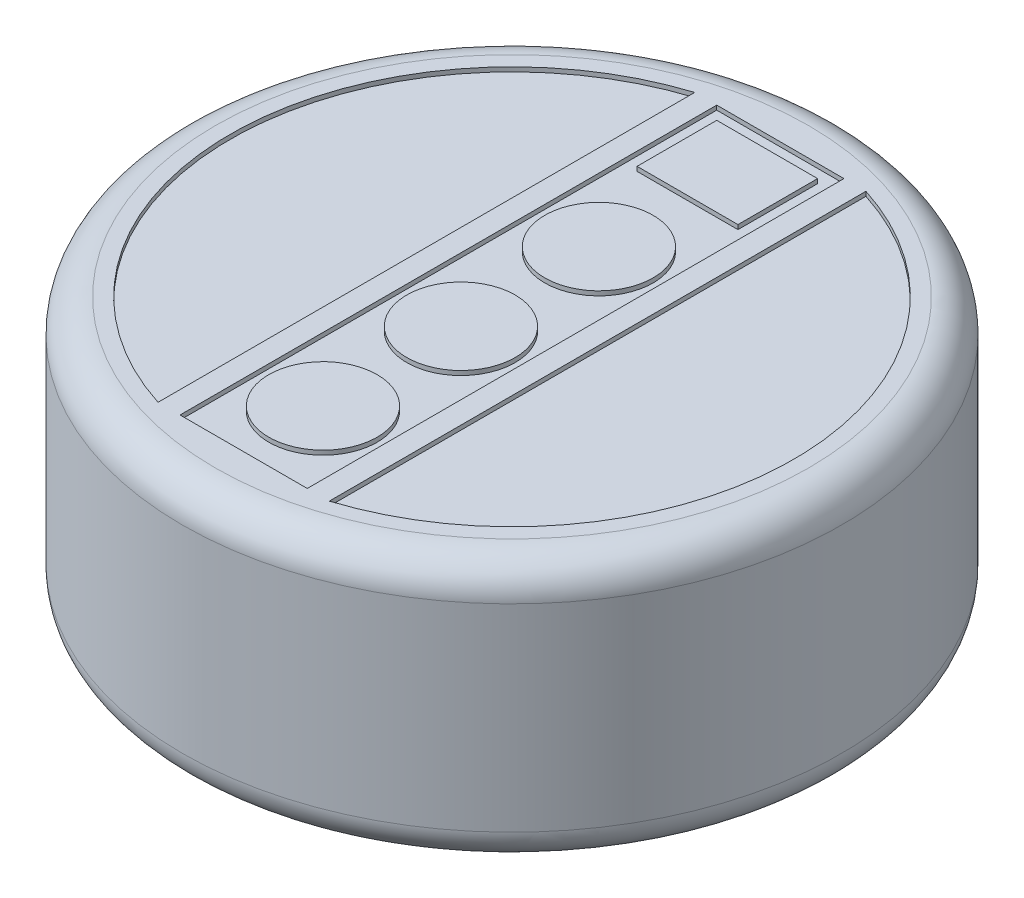
from build123d import *

# Parameters (mm, degrees)
SKETCH1_R           = 190.5
BOSS_EXTRUDE1_DEPTH = 152.4
SKETCH4_W           = 73.557387936
SKETCH4_H           = 310.235544462
CUT_EXTRUDE2_DEPTH  = 2.54
SKETCH5_R           = 31.334472959
SKETCH5_W           = 58.317387936
SKETCH5_H           = 46.041460357
BOSS_EXTRUDE3_DEPTH = 2.54
SKETCH6_W           = 25.4
SKETCH6_H           = 63.5
CUT_EXTRUDE3_DEPTH  = 38.1
FILLET3_R           = 19.05


with BuildPart() as part:
    # Sketch1 → Boss-Extrude1 (new body)
    with BuildSketch(Plane(origin=(0, 0, 0), x_dir=(1, 0, 0), z_dir=(0, 1, 0))):
        Circle(SKETCH1_R)
    extrude(amount=BOSS_EXTRUDE1_DEPTH)

    # Sketch4 → Cut-Extrude2 (cut)
    with BuildSketch(Plane(origin=(0, 152.4, 0), x_dir=(1, 0, 0), z_dir=(0, 1, 0))):
        with BuildLine():
            Line((-49.478693968, 155.117772231), (-49.478693968, -155.117772231))
            ThreePointArc((-49.478693968, -155.117772231), (-162.817887281, 0), (-49.478693968, 155.117772231))
        make_face()
        with BuildLine():
            Line((49.478693968, 155.117772231), (49.478693968, -155.117772231))
            ThreePointArc((49.478693968, -155.117772231), (162.817887281, 0), (49.478693968, 155.117772231))
        make_face()
        Rectangle(SKETCH4_W, SKETCH4_H)
    extrude(amount=-CUT_EXTRUDE2_DEPTH, mode=Mode.SUBTRACT)

    # Sketch5 → Boss-Extrude3 (add)
    with BuildSketch(Plane(origin=(0, 149.86, 0), x_dir=(1, 0, 0), z_dir=(0, 1, 0))):
        with Locations((0, 50.250313703)):
            Circle(SKETCH5_R)
        with Locations((0, -29.505686297)):
            Circle(SKETCH5_R)
        with Locations((0, -109.261686297)):
            Circle(SKETCH5_R)
        with Locations((0, 124.477042052)):
            Rectangle(SKETCH5_W, SKETCH5_H)
    extrude(amount=BOSS_EXTRUDE3_DEPTH)

    # Sketch6 → Cut-Extrude3 (cut)
    with BuildSketch(Plane.XZ):
        with Locations((-153.728334256, 2.735150341)):
            Rectangle(SKETCH6_W, SKETCH6_H)
        with Locations((152.139955728, 2.262697534)):
            Rectangle(SKETCH6_W, SKETCH6_H)
    extrude(amount=-CUT_EXTRUDE3_DEPTH, mode=Mode.SUBTRACT)

    # Fillet3
    fillet3_edges = [part.edges().sort_by_distance(p)[0] for p in [
        (-190.5, 0, 0),
        (-190.5, 152.4, 0),
    ]]
    fillet(fillet3_edges, radius=FILLET3_R)


solid = part.part
